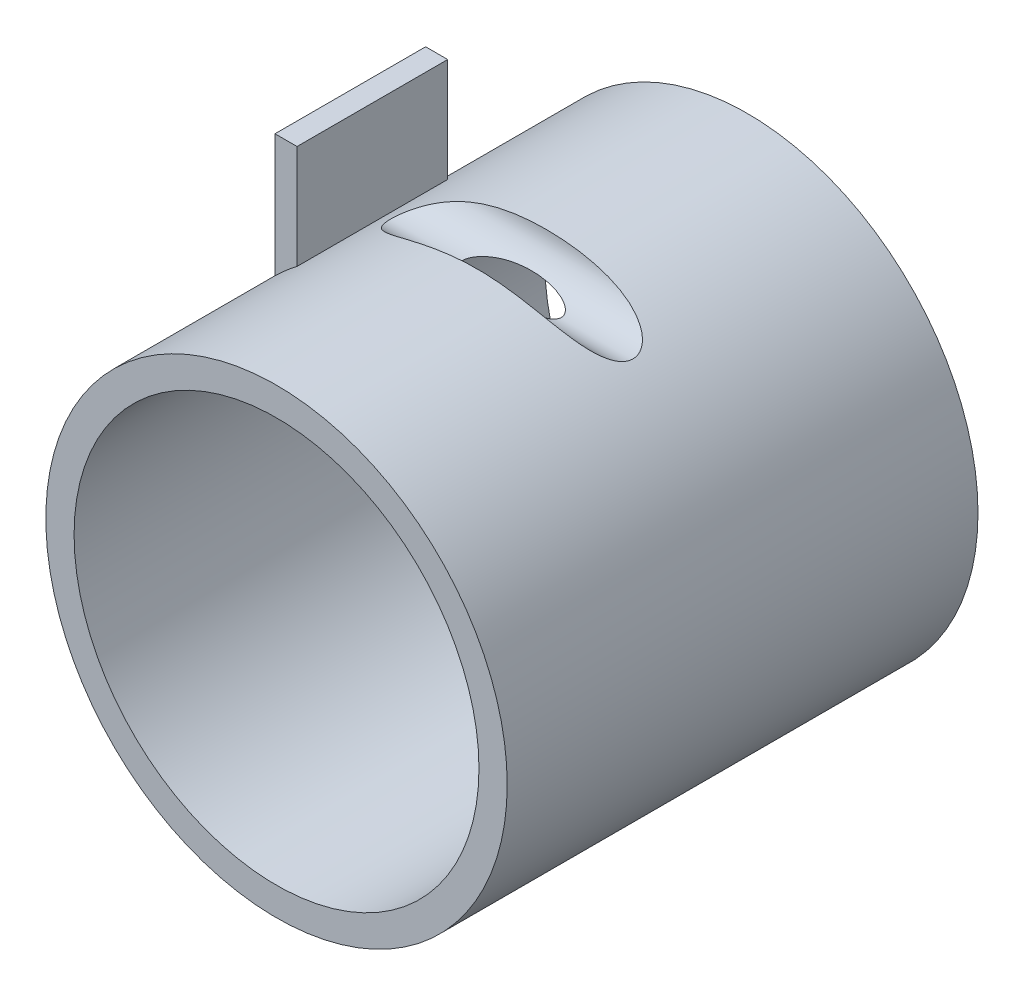
from build123d import *

# Parameters (mm, degrees)
SKETCH1_R           = 24.5
SKETCH1_R_2         = 21.5
BOSS_EXTRUDE1_DEPTH = 50
SKETCH3_R           = 3.65
CUT_EXTRUDE1_DEPTH  = 25
BOSS_EXTRUDE2_DEPTH = 8


with BuildPart() as part:
    # Sketch1 → Boss-Extrude1 (new body)
    with BuildSketch(Plane.XY):
        Circle(SKETCH1_R)
        Circle(SKETCH1_R_2, mode=Mode.SUBTRACT)
    extrude(amount=BOSS_EXTRUDE1_DEPTH)

    # Sketch3 → Cut-Extrude1 (cut, symmetric)
    with BuildSketch(Plane(origin=(0, 0, 0), x_dir=(0, 0, -1), z_dir=(1, 0, 0))):
        with Locations((-25, 24.5)):
            Circle(SKETCH3_R)
    extrude(amount=CUT_EXTRUDE1_DEPTH, both=True, mode=Mode.SUBTRACT)

    # Sketch4 → Boss-Extrude2 (add, symmetric)
    with BuildSketch(Plane.XY.offset(25)):
        with BuildLine():
            Line((-14.820151242, 19.509308475), (-14.820151242, 30.541585551))
            Line((-14.820151242, 30.541585551), (-17.163506901, 30.541585551))
            Line((-17.163506901, 30.541585551), (-17.163506901, 17.483250009))
            ThreePointArc((-17.163506901, 17.483250009), (-16.023882965, 18.533353035), (-14.820151242, 19.509308475))
        make_face()
    extrude(amount=BOSS_EXTRUDE2_DEPTH, both=True)


solid = part.part
